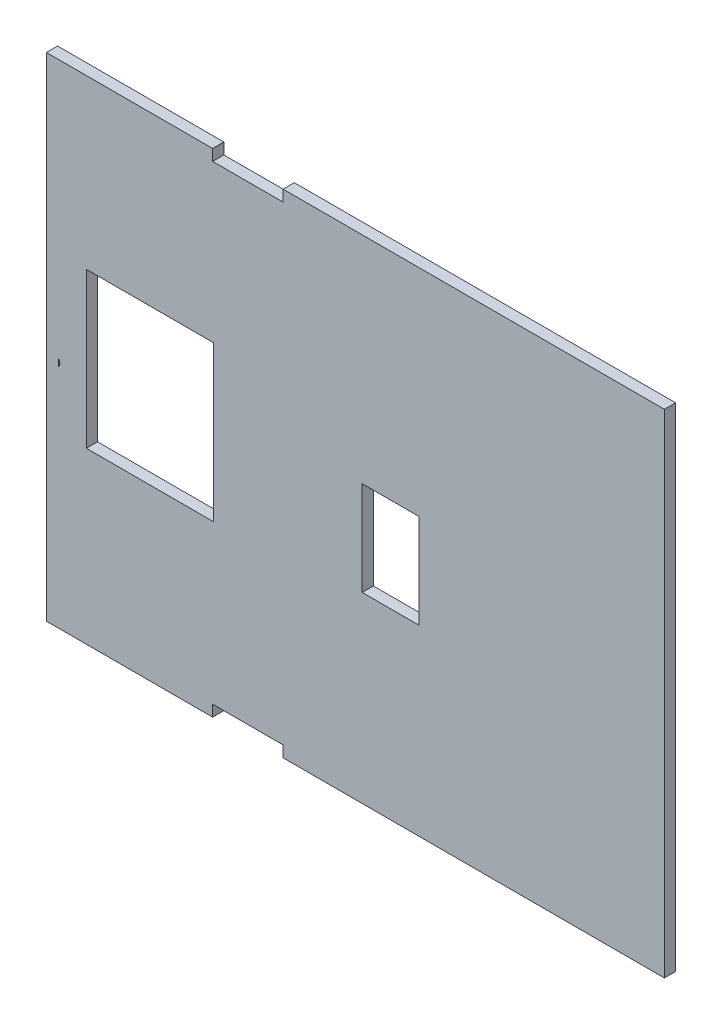
from build123d import *

# Parameters (mm, degrees)
SKETCH1_W                = 175
SKETCH1_H                = 139.7
BOSS_EXTRUDE1_DEPTH      = 3.18
SKETCH2_R                = 1.5
SKETCH2_W                = 3.18
SKETCH2_H                = 59.975
CUT_EXTRUDE1_DEPTH       = 113.006182419
SKETCH3_R                = 1.59
CUT_EXTRUDE2_DEPTH       = 113.006182419
SKETCH4_R                = 1.59
CUT_EXTRUDE3_DEPTH       = 113.006182419
SKETCH5_W                = 91.926224914
SKETCH5_H                = 123.656630911
BOSS_EXTRUDE2_DEPTH      = 3.18
SKETCH6_W                = 3.18
SKETCH6_H                = 19.75
CUT_EXTRUDE4_DEPTH       = 113.006182419
SKETCH8_W                = 25.560381265
SKETCH8_H                = 19.67928192
BOSS_EXTRUDE3_DEPTH      = 3.18
SKETCH10_W               = 20
SKETCH10_H               = 2.468001363
BOSS_EXTRUDE4_DEPTH      = 3.18
CUT_EXTRUDE5_DEPTH       = 113.006182419
SKETCH12_W               = 36.012104279
SKETCH12_H               = 43.960205632
CUT_EXTRUDE6_DEPTH       = 113.006182419
SKETCH13_W               = 16.174082381
SKETCH13_H               = 26.705141904
CUT_EXTRUDE7_DEPTH       = 113.006182419
BOSS_EXTRUDE5_DEPTH      = 3.18
BOSS_EXTRUDE5_DEPTH_BACK = 5
SKETCH14_W               = 3.18
SKETCH14_H               = 139.7
SKETCH16_W               = 18.884338216
SKETCH16_H               = 121.056150973
SKETCH16_W_2             = 10.857087527
SKETCH16_H_2             = 35.437593219
SKETCH16_W_3             = 28.428801023
SKETCH16_H_3             = 14.001351757
SKETCH16_W_4             = 22.576937907
SKETCH16_H_4             = 16.729537969
BOSS_EXTRUDE6_DEPTH      = 3.18
BOSS_EXTRUDE7_DEPTH      = 3.18
SKETCH18_W               = 175.308220565
SKETCH18_H               = 9.818804637
CUT_EXTRUDE8_DEPTH       = 3.18
SKETCH19_W               = 20
SKETCH19_H               = 3.18
CUT_EXTRUDE9_DEPTH       = 5


with BuildPart() as part:
    # Sketch1 → Boss-Extrude1 (new body)
    with BuildSketch(Plane.XY):
        Rectangle(SKETCH1_W, SKETCH1_H)
    extrude(amount=BOSS_EXTRUDE1_DEPTH)

    # Sketch2 → Cut-Extrude1 (cut, through all)
    with BuildSketch(Plane.XY.offset(3.18)):
        with Locations((-85.5, 0)):
            Circle(SKETCH2_R)
        with Locations((85.5, 0)):
            Circle(SKETCH2_R)
        Polygon((-10, 69.85), (10, 69.85), (10, 66.67), (1.5, 66.67), (1.5, 62.67), (3.5, 62.67), (3.5, 59.67), (1.5, 59.67), (1.5, 56.67), (-1.5, 56.67), (-1.5, 59.67), (-3.5, 59.67), (-3.5, 62.67), (-1.5, 62.67), (-1.5, 66.67), (-10, 66.67), align=None)
        Polygon((-10, -69.85), (-10, -66.67), (-1.5, -66.67), (-1.5, -62.67), (-3.5, -62.67), (-3.5, -59.67), (-1.5, -59.67), (-1.5, -56.67), (1.5, -56.67), (1.5, -59.67), (3.5, -59.67), (3.5, -62.67), (1.5, -62.67), (1.5, -66.67), (10, -66.67), (10, -69.85), align=None)
        with Locations((-85.91, 39.8625)):
            Rectangle(SKETCH2_W, SKETCH2_H)
        with Locations((-85.91, -39.8625)):
            Rectangle(SKETCH2_W, SKETCH2_H)
        with Locations((85.91, -39.8625)):
            Rectangle(SKETCH2_W, SKETCH2_H)
        with Locations((85.91, 39.8625)):
            Rectangle(SKETCH2_W, SKETCH2_H)
        Polygon((-28.854904074, -66.67), (-20.334061159, -66.67), (-20.334061159, -69.85), (-40.334061159, -69.85), (-40.334061159, -66.67), (-31.854904074, -66.67), (-31.854904074, -62.67), (-33.77295002, -62.67), (-33.77295002, -59.67), (-31.854904074, -59.67), (-31.854904074, -56.85), (-28.854904074, -56.85), (-28.854904074, -59.67), (-26.77295002, -59.67), (-26.77295002, -62.67), (-28.854904074, -62.67), align=None)
    extrude(amount=-CUT_EXTRUDE1_DEPTH, mode=Mode.SUBTRACT)

    # Sketch3 → Cut-Extrude2 (cut, through all)
    with BuildSketch(Plane(origin=(0, 0, 0), x_dir=(-1, 0, 0), z_dir=(0, 0, -1))):
        with Locations((-35.67127699, -47.963396943)):
            Circle(SKETCH3_R)
        with Locations((-35.67127699, -30.777287406)):
            Circle(SKETCH3_R)
    extrude(amount=-CUT_EXTRUDE2_DEPTH, mode=Mode.SUBTRACT)

    # Sketch4 → Cut-Extrude3 (cut, through all)
    with BuildSketch(Plane(origin=(0, 0, 0), x_dir=(-1, 0, 0), z_dir=(0, 0, -1))):
        with Locations((-34.750723073, 53.780323187)):
            Circle(SKETCH4_R)
        with Locations((-34.750723073, 36.59421365)):
            Circle(SKETCH4_R)
        with Locations((36.249784221, 53.780323187)):
            Circle(SKETCH4_R)
        with Locations((36.249784221, 36.59421365)):
            Circle(SKETCH4_R)
        with Locations((35.983928162, -30.777287406)):
            Circle(SKETCH4_R)
        with Locations((35.983928162, -47.963396943)):
            Circle(SKETCH4_R)
        with Locations((-35.67127699, -30.777287406)):
            Circle(SKETCH4_R)
        with Locations((-35.67127699, -47.963396943)):
            Circle(SKETCH4_R)
    extrude(amount=-CUT_EXTRUDE3_DEPTH, mode=Mode.SUBTRACT)

    # Sketch5 → Boss-Extrude2 (add)
    with BuildSketch(Plane.XY.offset(3.18)):
        with Locations((-0.563564665, 5.553683182)):
            Rectangle(SKETCH5_W, SKETCH5_H)
    extrude(amount=-BOSS_EXTRUDE2_DEPTH)

    # Sketch6 → Cut-Extrude4 (cut, through all)
    with BuildSketch(Plane(origin=(0, 0, 0), x_dir=(-1, 0, 0), z_dir=(0, 0, -1))):
        with Locations((-25.21, 0.03599429)):
            Rectangle(SKETCH6_W, SKETCH6_H)
        with Locations((13.073612417, 0)):
            Rectangle(SKETCH6_W, SKETCH6_H)
    extrude(amount=-CUT_EXTRUDE4_DEPTH, mode=Mode.SUBTRACT)

    # Sketch8 → Boss-Extrude3 (add)
    with BuildSketch(Plane(origin=(0, 0, 0), x_dir=(-1, 0, 0), z_dir=(0, 0, -1))):
        with Locations((-2.780190633, -60.01035904)):
            Rectangle(SKETCH8_W, SKETCH8_H)
    extrude(amount=-BOSS_EXTRUDE3_DEPTH)

    # Sketch10 → Boss-Extrude4 (add)
    with BuildSketch(Plane(origin=(0, 0, 0), x_dir=(-1, 0, 0), z_dir=(0, 0, -1))):
        with Locations((0, 68.615999319)):
            Rectangle(SKETCH10_W, SKETCH10_H)
    extrude(amount=-BOSS_EXTRUDE4_DEPTH)

    # Sketch11 → Cut-Extrude5 (cut, through all)
    with BuildSketch(Plane(origin=(0, 0, 0), x_dir=(-1, 0, 0), z_dir=(0, 0, -1))):
        Polygon((20.793148035, 66.67), (29.479057969, 66.67), (29.479057969, 62.67), (27.293148035, 62.67), (27.293148035, 59.67), (29.479057969, 59.67), (29.479057969, 56.85), (32.479057969, 56.85), (32.479057969, 59.67), (34.293148035, 59.67), (34.293148035, 62.67), (32.479057969, 62.67), (32.479057969, 66.67), (40.793148035, 66.67), (40.793148035, 69.85), (20.793148035, 69.85), align=None)
    extrude(amount=-CUT_EXTRUDE5_DEPTH, mode=Mode.SUBTRACT)

    # Sketch12 → Cut-Extrude6 (cut, through all)
    with BuildSketch(Plane(origin=(0, 0, 0), x_dir=(-1, 0, 0), z_dir=(0, 0, -1))):
        with Locations((58.477018613, 4.914539536)):
            Rectangle(SKETCH12_W, SKETCH12_H)
    extrude(amount=-CUT_EXTRUDE6_DEPTH, mode=Mode.SUBTRACT)

    # Sketch13 → Cut-Extrude7 (cut, through all)
    with BuildSketch(Plane(origin=(0, 0, 0), x_dir=(-1, 0, 0), z_dir=(0, 0, -1))):
        with Locations((-9.848843291, 0)):
            Rectangle(SKETCH13_W, SKETCH13_H)
    extrude(amount=-CUT_EXTRUDE7_DEPTH, mode=Mode.SUBTRACT)

    # Sketch14 → Boss-Extrude5 (add, two sides: drawn at the far end of the back side and taken through both)
    with BuildSketch(Plane(origin=(84.32, 0, 0), x_dir=(0, 0, -1), z_dir=(1, 0, 0)).offset(-BOSS_EXTRUDE5_DEPTH_BACK)):
        with Locations((-1.59, 0)):
            Rectangle(SKETCH14_W, SKETCH14_H)
    extrude(amount=BOSS_EXTRUDE5_DEPTH + BOSS_EXTRUDE5_DEPTH_BACK)

    # Sketch16 → Boss-Extrude6 (add)
    with BuildSketch(Plane(origin=(0, 0, 0), x_dir=(-1, 0, 0), z_dir=(0, 0, -1))):
        with Locations((-31.859595144, -9.321924514)):
            Rectangle(SKETCH16_W, SKETCH16_H)
        with Locations((12.113243242, -1.915189585)):
            Rectangle(SKETCH16_W_2, SKETCH16_H_2)
        with Locations((31.756187516, -62.849324122)):
            Rectangle(SKETCH16_W_3, SKETCH16_H_3)
        with Locations((32.081616989, 61.485231016)):
            Rectangle(SKETCH16_W_4, SKETCH16_H_4)
    extrude(amount=-BOSS_EXTRUDE6_DEPTH)

    # Sketch17 → Boss-Extrude7 (add)
    with BuildSketch(Plane(origin=(0, 0, 0), x_dir=(-1, 0, 0), z_dir=(0, 0, -1))):
        Polygon((-87.5, -69.85), (84.32, -69.85), (84.32, 69.85), (-87.5, 69.85), (-87.5, 74.493800826), (84.32, 74.493800826), (87.808220565, 74.493800826), (87.808220565, -69.85), (87.808220565, -75.025003811), (84.32, -75.025003811), (-87.5, -75.025003811), align=None)
    extrude(amount=-BOSS_EXTRUDE7_DEPTH)

    # Sketch18 → Cut-Extrude8 (cut)
    with BuildSketch(Plane.XY.offset(3.18)):
        with Locations((-0.154110282, -70.115601493)):
            Rectangle(SKETCH18_W, SKETCH18_H)
    extrude(amount=-CUT_EXTRUDE8_DEPTH, mode=Mode.SUBTRACT)

    # Sketch19 → Cut-Extrude9 (cut)
    with BuildSketch(Plane(origin=(0, 0, 0), x_dir=(-1, 0, 0), z_dir=(0, 0, -1))):
        with Locations((30.658220565, -63.616199174)):
            Rectangle(SKETCH19_W, SKETCH19_H)
        with Locations((30.658220565, 72.903800826)):
            Rectangle(SKETCH19_W, SKETCH19_H)
    extrude(amount=-CUT_EXTRUDE9_DEPTH, mode=Mode.SUBTRACT)


solid = part.part
